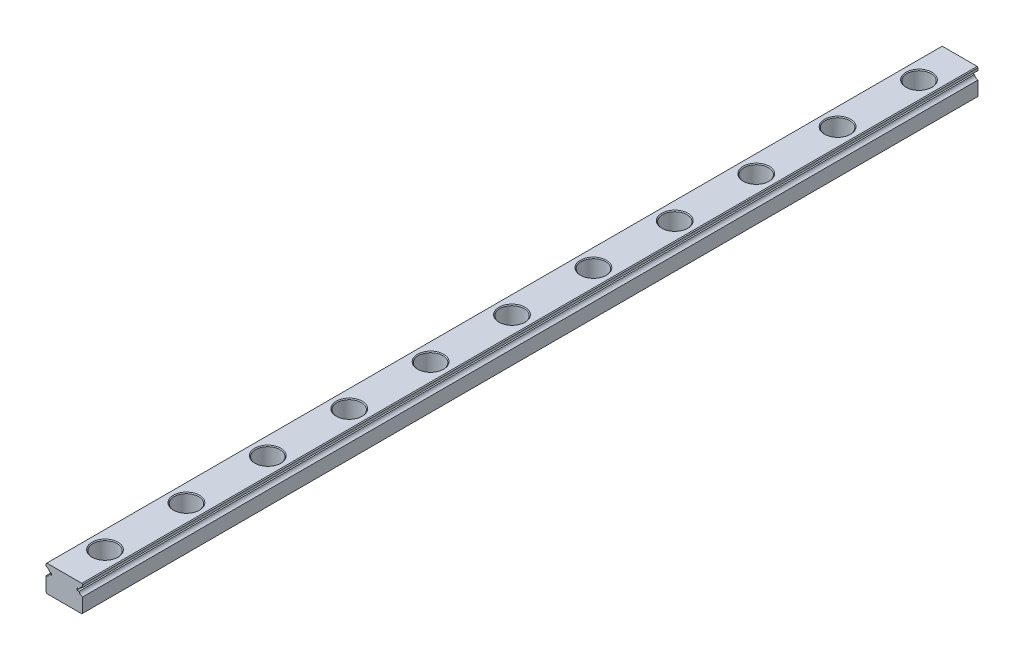
from build123d import *

# Parameters (mm, degrees)
EXTRUDE1_DEPTH                     = 220
HOLE_WIZARD_M3_1_D                 = 3.5
HOLE_WIZARD_M3_1_CBORE_D           = 6
HOLE_WIZARD_M3_1_CBORE_DEPTH       = 4.5
CHAMFER_1_SIZE                     = 0.2
PATTERN_LINEAR_1_COUNT             = 11
PATTERN_LINEAR_1_PITCH             = 20
CHAMFER_1_OF_PATTERN_LINEAR_1_SIZE = 0.2


with BuildPart() as part:
    # Sketch1 → Extrude1 (new body)
    with BuildSketch(Plane.XY):
        with BuildLine():
            Line((-4.3, -3.25), (4.3, -3.25))
            Line((4.3, -3.25), (4.5, -3.05))
            Line((4.5, -3.05), (4.5, 0.455012563))
            ThreePointArc((4.5, 0.455012563), (3.948817336, 0.691078965), (3.631754163, 1.2))
            Line((3.631754163, 1.2), (3.131754163, 1.2))
            Line((3.131754163, 1.2), (3.131754163, 1.7))
            Line((3.131754163, 1.7), (3.631754163, 1.7))
            ThreePointArc((3.631754163, 1.7), (3.948817336, 2.208921035), (4.5, 2.444987437))
            Line((4.5, 2.444987437), (4.5, 3.05))
            Line((4.5, 3.05), (4.3, 3.25))
            Line((4.3, 3.25), (-4.3, 3.25))
            Line((-4.3, 3.25), (-4.5, 3.05))
            Line((-4.5, 3.05), (-4.5, 2.444987437))
            ThreePointArc((-4.5, 2.444987437), (-3.948817336, 2.208921035), (-3.631754163, 1.7))
            Line((-3.631754163, 1.7), (-3.131754163, 1.7))
            Line((-3.131754163, 1.7), (-3.131754163, 1.2))
            Line((-3.131754163, 1.2), (-3.631754163, 1.2))
            ThreePointArc((-3.631754163, 1.2), (-3.948817336, 0.691078965), (-4.5, 0.455012563))
            Line((-4.5, 0.455012563), (-4.5, -3.05))
            Line((-4.5, -3.05), (-4.3, -3.25))
        make_face()
    extrude(amount=EXTRUDE1_DEPTH)

    # M3 平盤頭機械螺釘的柱孔1 (through all)
    with Locations(Plane(origin=(0, 3.25, 0), x_dir=(1, 0, 0), z_dir=(0, 1, 0))):
        with Locations((0, -10)):
            hole_wizard_m3_1 = CounterBoreHole(HOLE_WIZARD_M3_1_D / 2, HOLE_WIZARD_M3_1_CBORE_D / 2, HOLE_WIZARD_M3_1_CBORE_DEPTH)

    # 導角1
    chamfer_1_edges = [part.edges().sort_by_distance(p)[0] for p in [
        (1.75, -3.25, 10),
        (-3, 3.25, 10),
    ]]
    chamfer(chamfer_1_edges, length=CHAMFER_1_SIZE)

    # 直線複製排列1: M3 平盤頭機械螺釘的柱孔1 ×11
    with Locations(*[(0, 0, i * PATTERN_LINEAR_1_PITCH) for i in range(1, PATTERN_LINEAR_1_COUNT)]):
        add(hole_wizard_m3_1, mode=Mode.SUBTRACT)

    # 導角1 of 直線複製排列1
    chamfer_1_of_pattern_linear_1_edges = [part.edges().sort_by_distance(p)[0] for p in [
        (1.75, -3.25, 30),
        (-3, 3.25, 30),
        (1.75, -3.25, 50),
        (-3, 3.25, 50),
        (1.75, -3.25, 70),
        (-3, 3.25, 70),
        (1.75, -3.25, 90),
        (-3, 3.25, 90),
        (1.75, -3.25, 110),
        (-3, 3.25, 110),
        (1.75, -3.25, 130),
        (-3, 3.25, 130),
        (1.75, -3.25, 150),
        (-3, 3.25, 150),
        (1.75, -3.25, 170),
        (-3, 3.25, 170),
        (1.75, -3.25, 190),
        (-3, 3.25, 190),
        (1.75, -3.25, 210),
        (-3, 3.25, 210),
    ]]
    chamfer(chamfer_1_of_pattern_linear_1_edges, length=CHAMFER_1_OF_PATTERN_LINEAR_1_SIZE)


solid = part.part
